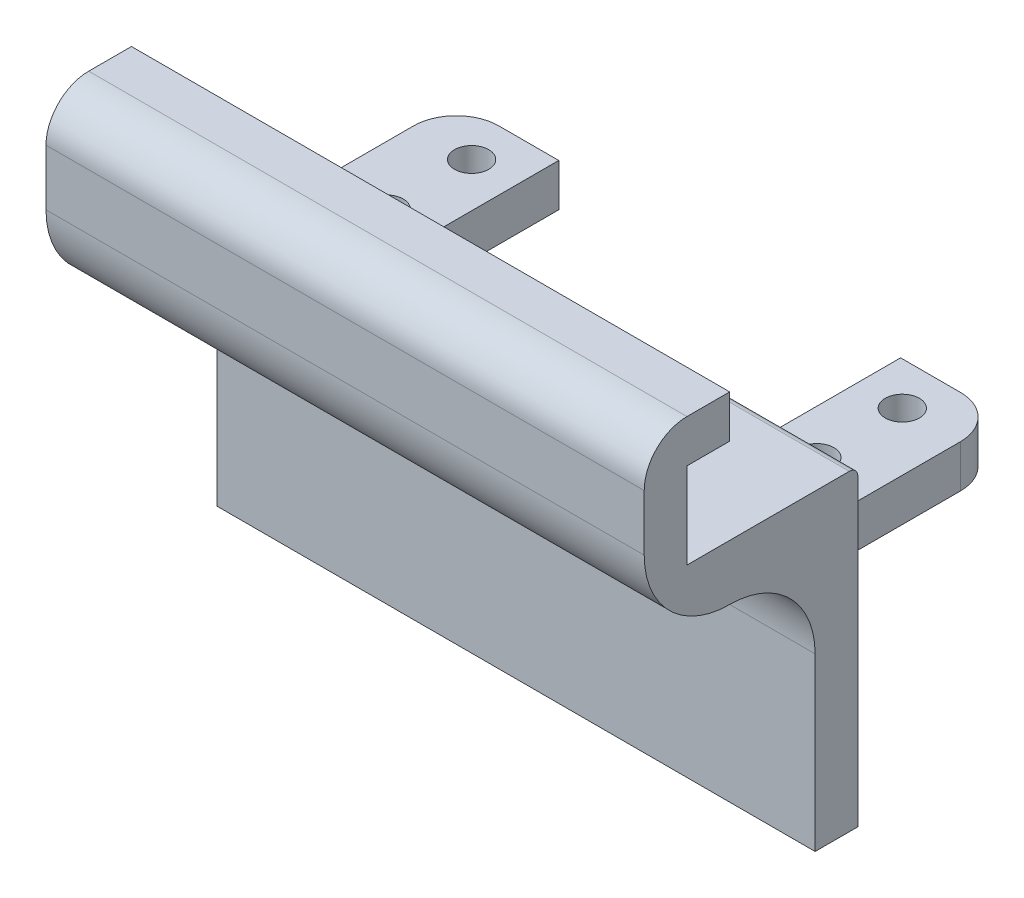
from build123d import *

# Parameters (mm, degrees)
ESQUISSE1_W             = 70
ESQUISSE1_H             = 30.03
BOSS_EXTRU_1_DEPTH      = 5
BOSS_EXTRU_2_START      = -5
ESQUISSE2_W             = 12
ESQUISSE2_H             = 5
BOSS_EXTRU_2_DEPTH      = 20
CONG_1_R                = 3
CONG_2_R                = 3
CONG_12_R               = 5
CONG_11_R               = 5
BOSS_EXTRU_5_DEPTH      = 70
CONG_13_R               = 10
CONG_14_R               = 5
ESQUISSE7_W             = 70
ESQUISSE7_H             = 5
BOSS_EXTRU_6_DEPTH      = 5
CONG_15_R               = 10
CONG_16_R               = 1
BOSS_EXTRU_7_START      = -2
BOSS_EXTRU_7_DEPTH      = 2
BOSS_EXTRU_8_START      = 4
BOSS_EXTRU_8_DEPTH      = 2
ESQUISSE11_R            = 2
ENL_V_MAT_EXTRU_1_DEPTH = 51.546043366
CONG_17_R               = 5


with BuildPart() as part:
    # Esquisse1 → Boss.-Extru.1 (new body)
    with BuildSketch(Plane.XY):
        Rectangle(ESQUISSE1_W, ESQUISSE1_H)
    extrude(amount=BOSS_EXTRU_1_DEPTH)

    # Esquisse2 → Boss.-Extru.2 (add)
    with BuildSketch(Plane.XY.offset(5).offset(BOSS_EXTRU_2_START)):
        with Locations((-26, 12.515)):
            Rectangle(ESQUISSE2_W, ESQUISSE2_H)
        with Locations((26, 12.515)):
            Rectangle(ESQUISSE2_W, ESQUISSE2_H)
    extrude(amount=-BOSS_EXTRU_2_DEPTH)

    # Congé1
    cong_1_edges = [part.edges().sort_by_distance(p)[0] for p in [
        (32, 12.515, 0),
    ]]
    fillet(cong_1_edges, radius=CONG_1_R - 0.0001)  # a hair under: the kernel refuses the full size

    # Congé2
    cong_2_edges = [part.edges().sort_by_distance(p)[0] for p in [
        (-32, 12.515, 0),
    ]]
    fillet(cong_2_edges, radius=CONG_2_R - 0.0001)  # a hair under: the kernel refuses the full size

    # Congé12
    cong_12_edges = [part.edges().sort_by_distance(p)[0] for p in [
        (-20, 12.515, 0),
    ]]
    fillet(cong_12_edges, radius=CONG_12_R)

    # Congé11
    cong_11_edges = [part.edges().sort_by_distance(p)[0] for p in [
        (20, 12.515, 0),
    ]]
    fillet(cong_11_edges, radius=CONG_11_R)

    # Esquisse6 → Boss.-Extru.5 (add, through all)
    with BuildSketch(Plane(origin=(35, 0, 0), x_dir=(0, 0, -1), z_dir=(1, 0, 0))):
        Polygon((-5, 15.015), (-25, 15.015), (-25, 36.565), (-20, 36.565), (-20, 21.515), (-5, 21.515), (0, 21.515), (0, 15.015), align=None)
    extrude(amount=-BOSS_EXTRU_5_DEPTH)

    # Congé13
    cong_13_edges = [part.edges().sort_by_distance(p)[0] for p in [
        (0, 15.015, 25),
    ]]
    fillet(cong_13_edges, radius=CONG_13_R)

    # Congé14
    cong_14_edges = [part.edges().sort_by_distance(p)[0] for p in [
        (0, 36.565, 25),
    ]]
    fillet(cong_14_edges, radius=CONG_14_R - 0.0001)  # a hair under: the kernel refuses the full size

    # Esquisse7 → Boss.-Extru.6 (add)
    with BuildSketch(Plane(origin=(0, 0, 20), x_dir=(-1, 0, 0), z_dir=(0, 0, -1))):
        with Locations((0, 34.065)):
            Rectangle(ESQUISSE7_W, ESQUISSE7_H)
    extrude(amount=BOSS_EXTRU_6_DEPTH)

    # Congé15
    cong_15_edges = [part.edges().sort_by_distance(p)[0] for p in [
        (0, 15.015, 5),
    ]]
    fillet(cong_15_edges, radius=CONG_15_R - 0.0001)  # a hair under: the kernel refuses the full size

    # Congé16
    cong_16_edges = [part.edges().sort_by_distance(p)[0] for p in [
        (0, 21.515, 0),
    ]]
    fillet(cong_16_edges, radius=CONG_16_R)

    # Esquisse8 → Boss.-Extru.7 (add)
    with BuildSketch(Plane(origin=(32, 0, 0), x_dir=(0, 0, -1), z_dir=(1, 0, 0)).offset(BOSS_EXTRU_7_START)):
        Polygon((1, 15.015), (0, 20.515), (0, 15.009679375), align=None)
    boss_extru_7 = extrude(amount=-BOSS_EXTRU_7_DEPTH)

    # Esquisse9 → Boss.-Extru.8 (add)
    with BuildSketch(Plane.ZY.offset(-28).offset(BOSS_EXTRU_8_START)):
        Polygon((0, 20.515), (-1, 15.015), (0, 15.015), align=None)
    boss_extru_8 = extrude(amount=BOSS_EXTRU_8_DEPTH)

    # Symétrie3: Boss.-Extru.7, Boss.-Extru.8 across plane
    add(boss_extru_7.mirror(Plane(origin=(0, 0, 0), x_dir=(0, 0, 1), z_dir=(1, 0, 0))))
    add(boss_extru_8.mirror(Plane(origin=(0, 0, 0), x_dir=(0, 0, 1), z_dir=(1, 0, 0))))

    # Esquisse11 → Enlèv. mat.-Extru.1 (cut, through all)
    with BuildSketch(Plane.XZ.offset(-10.015)):
        with Locations((25.2, -15)):
            Circle(ESQUISSE11_R)
        with Locations((25.2, -5)):
            Circle(ESQUISSE11_R)
        with Locations((-25.2, -15)):
            Circle(ESQUISSE11_R)
        with Locations((-25.2, -5)):
            Circle(ESQUISSE11_R)
    extrude(amount=-ENL_V_MAT_EXTRU_1_DEPTH, mode=Mode.SUBTRACT)

    # Congé17
    cong_17_edges = [part.edges().sort_by_distance(p)[0] for p in [
        (-32, 12.515, -20),
        (32, 12.515, -20),
    ]]
    fillet(cong_17_edges, radius=CONG_17_R)


solid = part.part
